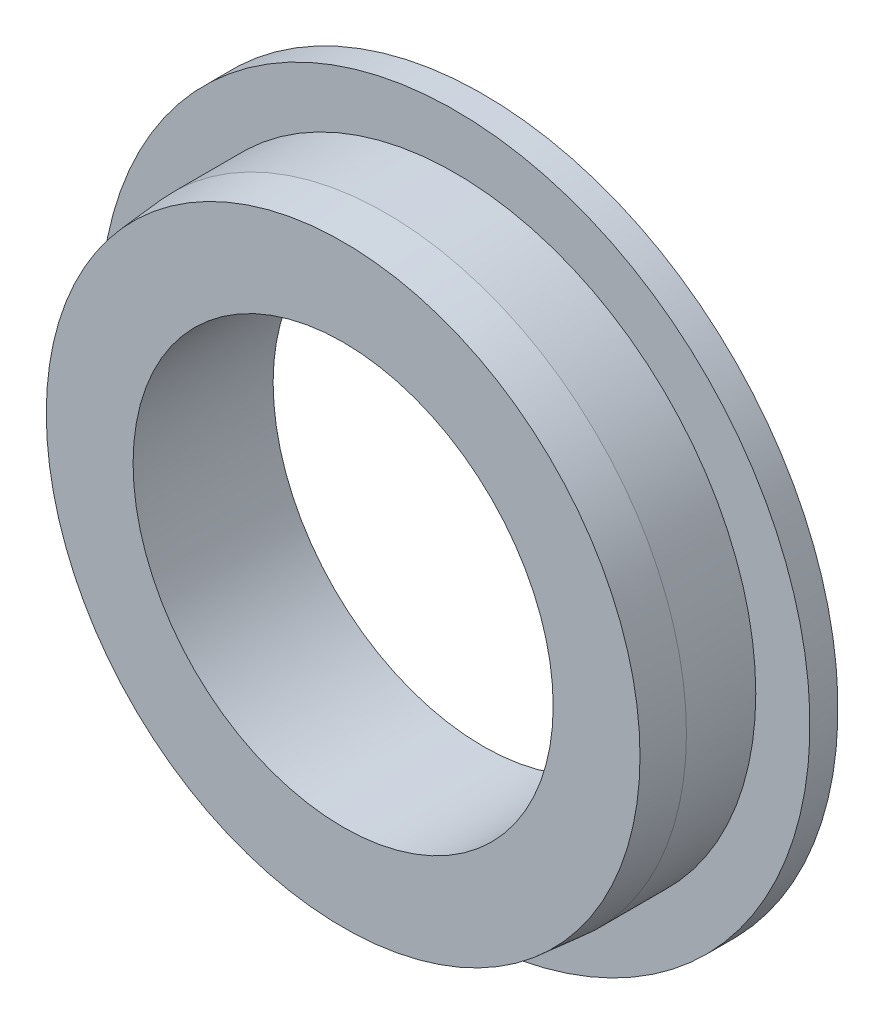
from build123d import *

# Parameters (mm, degrees)
SKETCH1_R           = 24.13
BOSS_EXTRUDE1_DEPTH = 0.9525
SKETCH2_R           = 20.447
BOSS_EXTRUDE2_DEPTH = 7.62
SKETCH4_R           = 14.2875
CUT_EXTRUDE1_DEPTH  = 36.429358236
CHAMFER1_SIZE       = 0.254
CHAMFER1_SIZE2      = 2.903233285


with BuildPart() as part:
    # Sketch1 → Boss-Extrude1 (new, symmetric)
    with BuildSketch(Plane.XY):
        Circle(SKETCH1_R)
    extrude(amount=BOSS_EXTRUDE1_DEPTH, both=True)

    # Sketch2 → Boss-Extrude2 (add)
    with BuildSketch(Plane.XY.offset(0.9525)):
        Circle(SKETCH2_R)
    extrude(amount=BOSS_EXTRUDE2_DEPTH)

    # Sketch4 → Cut-Extrude1 (cut, through all)
    with BuildSketch(Plane(origin=(0, 0, -0.9525), x_dir=(-1, 0, 0), z_dir=(0, 0, -1))):
        Circle(SKETCH4_R)
    extrude(amount=-CUT_EXTRUDE1_DEPTH, mode=Mode.SUBTRACT)

    # Chamfer1
    chamfer1_edges = [part.edges().sort_by_distance(p)[0] for p in [
        (-20.447, 0, 8.5725),
    ]]
    chamfer1_side = [part.faces().sort_by_distance(p)[0] for p in [
        (-19.868671506, 0, 8.5725),
    ]]
    chamfer(chamfer1_edges, length=CHAMFER1_SIZE, length2=CHAMFER1_SIZE2, reference=chamfer1_side[0])


solid = part.part
